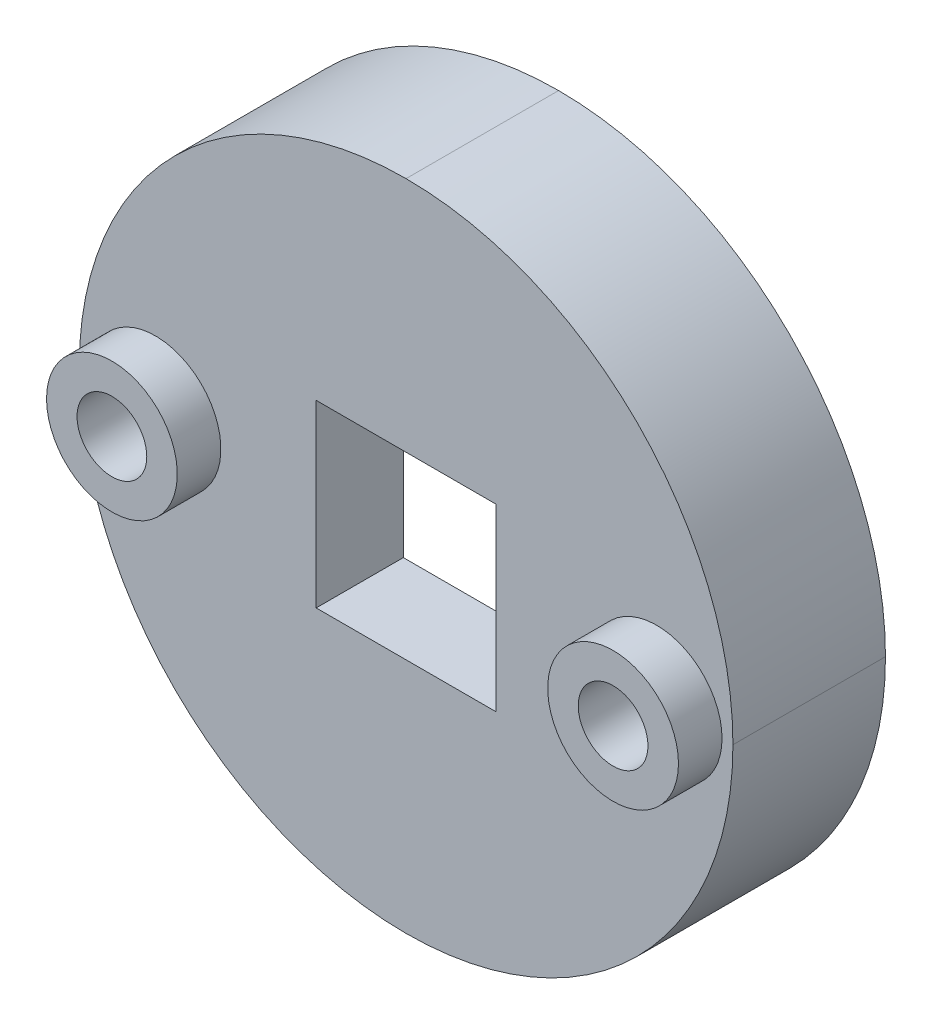
from build123d import *

# Parameters (mm, degrees)
SKETCH_1_W          = 30
SKETCH_1_H          = 30
EXTRUDE_1_DEPTH     = 7
SKETCH_2_W          = 8.25
SKETCH_2_H          = 8.25
CUT_EXTRUDE_1_DEPTH = 23.338307904
SKETCH_3_R          = 3
EXTRUDE_2_DEPTH     = 2
SKETCH_4_R          = 1.6
CUT_EXTRUDE_2_DEPTH = 5
SKETCH_5_R          = 12.625
CUT_EXTRUDE_3_DEPTH = 3
FILLET_1_R          = 15


with BuildPart() as part:
    # Эскиз1 → Бобышка-Вытянуть1 (new body)
    with BuildSketch(Plane.XY):
        Rectangle(SKETCH_1_W, SKETCH_1_H)
    extrude(amount=EXTRUDE_1_DEPTH)

    # Эскиз2 → Вырез-Вытянуть1 (cut, through all)
    with BuildSketch(Plane.XY.offset(7)):
        Rectangle(SKETCH_2_W, SKETCH_2_H)
    extrude(amount=-CUT_EXTRUDE_1_DEPTH, mode=Mode.SUBTRACT)

    # Эскиз3 → Бобышка-Вытянуть2 (add)
    with BuildSketch(Plane.XY.offset(7)):
        with Locations((11.5, 0)):
            Circle(SKETCH_3_R)
        with Locations(Location((-11.5, 0, 0), (0, 0, 180))):
            Circle(SKETCH_3_R)
    extrude(amount=EXTRUDE_2_DEPTH)

    # Эскиз4 → Вырез-Вытянуть2 (cut)
    with BuildSketch(Plane.XY.offset(9)):
        with Locations((-11.5, 0)):
            Circle(SKETCH_4_R)
        with Locations((11.5, 0)):
            Circle(SKETCH_4_R)
    extrude(amount=-CUT_EXTRUDE_2_DEPTH, mode=Mode.SUBTRACT)

    # Эскиз5 → Вырез-Вытянуть3 (cut)
    with BuildSketch(Plane(origin=(0, 0, 0), x_dir=(-1, 0, 0), z_dir=(0, 0, -1))):
        Circle(SKETCH_5_R)
    extrude(amount=-CUT_EXTRUDE_3_DEPTH, mode=Mode.SUBTRACT)

    # Скругление1
    fillet_1_edges = [part.edges().sort_by_distance(p)[0] for p in [
        (-15, 15, 3.5),
        (15, 15, 3.5),
        (15, -15, 3.5),
        (-15, -15, 3.5),
    ]]
    fillet(fillet_1_edges, radius=FILLET_1_R - 0.0001)  # a hair under: the kernel refuses the full size


solid = part.part
